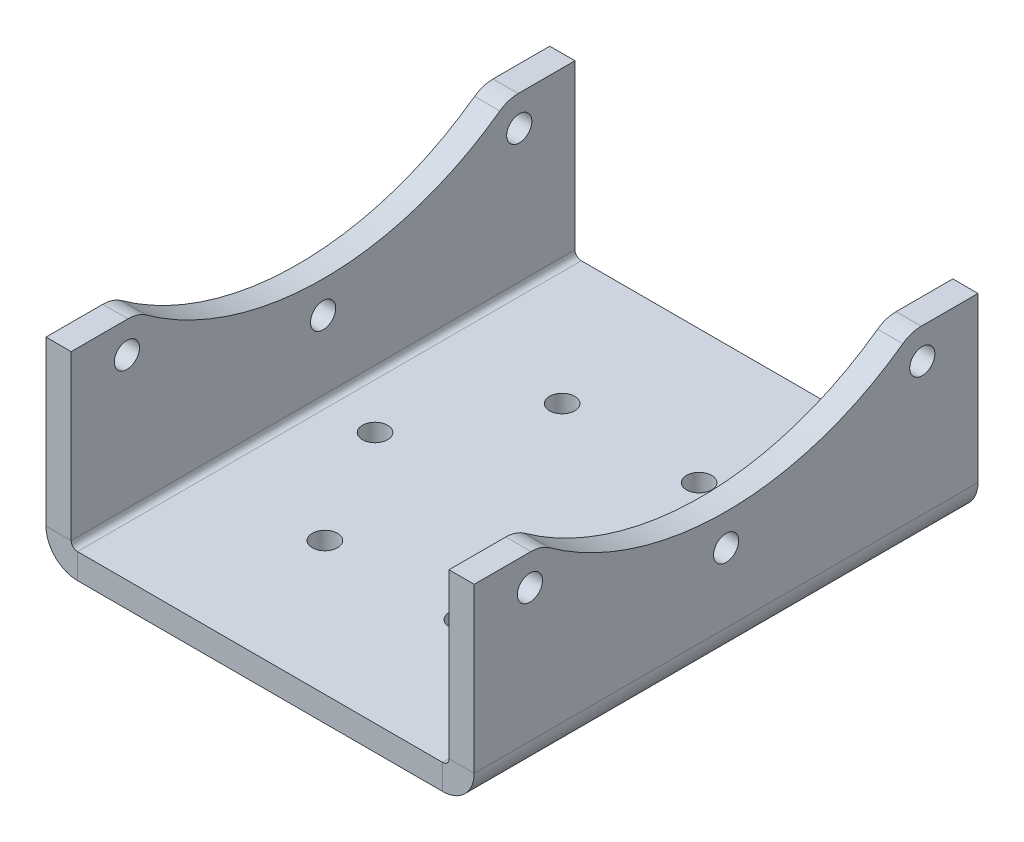
from build123d import *

# Parameters (mm, degrees)
SM_BASE_FLANGE_1_DEPTH   = 80
CUT_EXTRUDE_3_DEPTH      = 109.411254028
CUT_EXTRUDE_3_DEPTH_BACK = 109.411254028
SKETCH_6_R               = 48
SKETCH_6_R_2             = 2
FILLET_1_R               = 5
SKETCH_9_R               = 2
CUT_EXTRUDE_4_DEPTH      = 93.287593966


# Sheet-metal steps are written as plain solids
with BuildPart() as part:
    # Sketch 1 → Базовая кромка1 (new body)
    with BuildSketch(Plane.XY):
        with BuildLine():
            Line((-30, 27), (-30, 1))
            ThreePointArc((-30, 1), (-29.707106781, 0.292893219), (-29, 0))
            Line((-29, 0), (29, 0))
            ThreePointArc((29, 0), (29.707106781, 0.292893219), (30, 1))
            Line((30, 1), (30, 27))
            Line((30, 27), (34, 27))
            Line((34, 27), (34, 1))
            ThreePointArc((34, 1), (32.535533906, -2.535533906), (29, -4))
            Line((29, -4), (-29, -4))
            ThreePointArc((-29, -4), (-32.535533906, -2.535533906), (-34, 1))
            Line((-34, 1), (-34, 27))
            Line((-34, 27), (-30, 27))
        make_face()
    extrude(amount=SM_BASE_FLANGE_1_DEPTH)

    # Эскиз6 → Вырез-Вытянуть3 (cut, two sides: drawn at the far end of the back side and taken through both)
    with BuildSketch(Plane.ZY.offset(34).offset(-CUT_EXTRUDE_3_DEPTH_BACK)):
        with Locations((40, 65)):
            Circle(SKETCH_6_R)
        with Locations((40, 12)):
            Circle(SKETCH_6_R_2)
        with Locations((8.847381628, 22.122099298)):
            Circle(SKETCH_6_R_2)
        with Locations((71.152618372, 22.122099298)):
            Circle(SKETCH_6_R_2)
    extrude(amount=CUT_EXTRUDE_3_DEPTH + CUT_EXTRUDE_3_DEPTH_BACK, mode=Mode.SUBTRACT)

    # Скругление1
    fillet_1_edges = [part.edges().sort_by_distance(p)[0] for p in [
        (32, 27, 10.674243403),
        (32, 27, 69.325756597),
        (-32, 27, 10.674243403),
        (-32, 27, 69.325756597),
    ]]
    fillet(fillet_1_edges, radius=FILLET_1_R)

    # Эскиз9 → Вырез-Вытянуть4 (cut, through all)
    with BuildSketch(Plane.XZ.offset(4)):
        with Locations((-21.75, 40)):
            Circle(SKETCH_9_R)
        with Locations((-10.875, 58.836052532)):
            Circle(SKETCH_9_R)
        with Locations((10.875, 58.836052532)):
            Circle(SKETCH_9_R)
        with Locations((21.75, 40)):
            Circle(SKETCH_9_R)
        with Locations((10.875, 21.163947468)):
            Circle(SKETCH_9_R)
        with Locations((-10.875, 21.163947468)):
            Circle(SKETCH_9_R)
    extrude(amount=-CUT_EXTRUDE_4_DEPTH, mode=Mode.SUBTRACT)


solid = part.part
